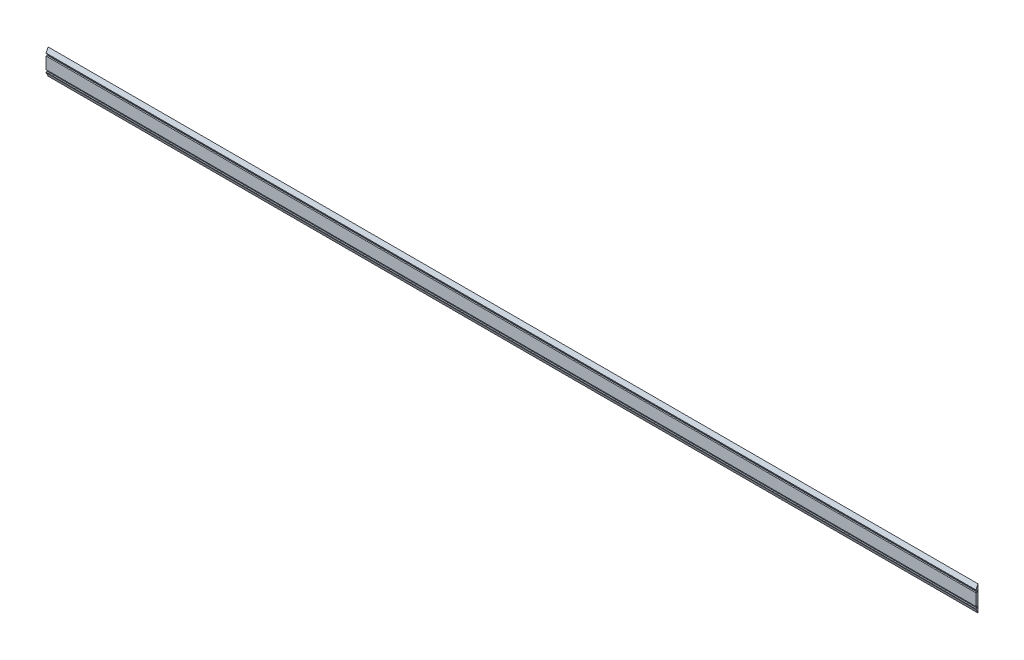
from build123d import *

# Parameters (mm, degrees)
SKETCH_1_W          = 2200
SKETCH_1_H          = 60
EXTRUDE_1_DEPTH     = 5
CHAMFER_1_SIZE      = 5
CHAMFER_1_SIZE_2    = 10
SKETCH_2_W          = 2200
SKETCH_2_H          = 5
CUT_EXTRUDE_2_DEPTH = 3


with BuildPart() as part:
    # Эскиз1 → Бобышка-Вытянуть1 (new body)
    with BuildSketch(Plane.XY):
        with Locations((1100, -30)):
            Rectangle(SKETCH_1_W, SKETCH_1_H)
    extrude(amount=EXTRUDE_1_DEPTH)

    # Фаска1
    # the kernel refuses this chamfer: 10, 5 mm, written as the material it takes off along each edge
    with BuildSketch(Plane(origin=(2225.898288738, 0, 5), x_dir=(0, 0.06891834360170877, -0.9976223042390326), z_dir=(-1, 0, 0)), Plane(origin=(-25.898288738, -60, 5), x_dir=(0, -0.06891834360170909, -0.9976223042390324), z_dir=(1, 0, 0))) as chamfer_1_piece_1:
        Polygon((CHAMFER_1_SIZE * 0.997622304239, CHAMFER_1_SIZE * 0.0689183436017), (-CHAMFER_1_SIZE_2 * 0.0689183436017, CHAMFER_1_SIZE_2 * 0.997622304239), (0, 0), align=None)
    extrude(amount=2251.796577476, mode=Mode.SUBTRACT)

    # Эскиз2 → Вырез-Вытянуть2 (cut)
    with BuildSketch(Plane.XY.offset(5)):
        with Locations((1100, -46.5)):
            Rectangle(SKETCH_2_W, SKETCH_2_H)
        with Locations((1100, -13.5)):
            Rectangle(SKETCH_2_W, SKETCH_2_H)
    extrude(amount=-CUT_EXTRUDE_2_DEPTH, mode=Mode.SUBTRACT)


solid = part.part
